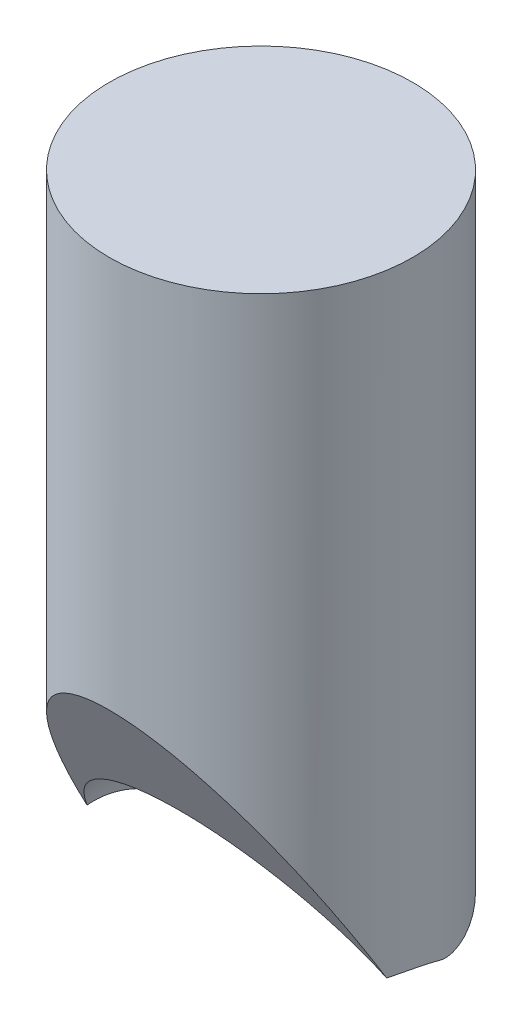
from build123d import *

# Parameters (mm, degrees)
SKETCH1_R               = 40
BOSS_EXTRUDE1_DEPTH     = 200
CUT_EXTRUDE2_DEPTH      = 208.846096908
CUT_EXTRUDE2_DEPTH_BACK = 208.846096908
SKETCH5_R               = 41
CUT_EXTRUDE4_DEPTH      = 190.048145492


with BuildPart() as part:
    # Sketch1 → Boss-Extrude1 (new body)
    with BuildSketch(Plane(origin=(0, 0, 0), x_dir=(1, 0, 0), z_dir=(0, 1, 0))):
        Circle(SKETCH1_R)
    extrude(amount=BOSS_EXTRUDE1_DEPTH)

    # Sketch4 → Cut-Extrude2 (cut, two sides: drawn at the far end of the back side and taken through both)
    with BuildSketch(Plane(origin=(0, 0, 0), x_dir=(0, 0, -1), z_dir=(1, 0, 0)).offset(-CUT_EXTRUDE2_DEPTH_BACK)):
        Polygon((-40, 96.648435062), (15.8, 0), (-40, 0), align=None)
    extrude(amount=CUT_EXTRUDE2_DEPTH + CUT_EXTRUDE2_DEPTH_BACK, mode=Mode.SUBTRACT)

    # Sketch5 → Cut-Extrude4 (cut, through all)
    with BuildSketch(Plane(origin=(0, 23.097337525, 13.335254038), x_dir=(1, 0, 0), z_dir=(1.241277536256746e-15, -0.8660254037844375, -0.5000000000000019))):
        with Locations((0, -12.434491924)):
            Circle(SKETCH5_R)
    extrude(amount=CUT_EXTRUDE4_DEPTH, mode=Mode.SUBTRACT)

    # Sketch8 → Cut-Revolve5 (revolve, cut)
    with BuildSketch(Plane(origin=(0, 23.097337525, 13.335254038), x_dir=(1, 0, 0), z_dir=(1.241277536256746e-15, -0.8660254037844376, -0.5000000000000019))):
        with BuildLine():
            Line((40.980980036, -13.68320138), (-40.980980036, -13.68320138))
            ThreePointArc((-40.980980036, -13.68320138), (0, -53.434491924), (40.980980036, -13.68320138))
        make_face()
    revolve(axis=Axis((40.980980036, 29.938938215, 1.485254038), (-1, 0, 0)), mode=Mode.SUBTRACT)


solid = part.part
